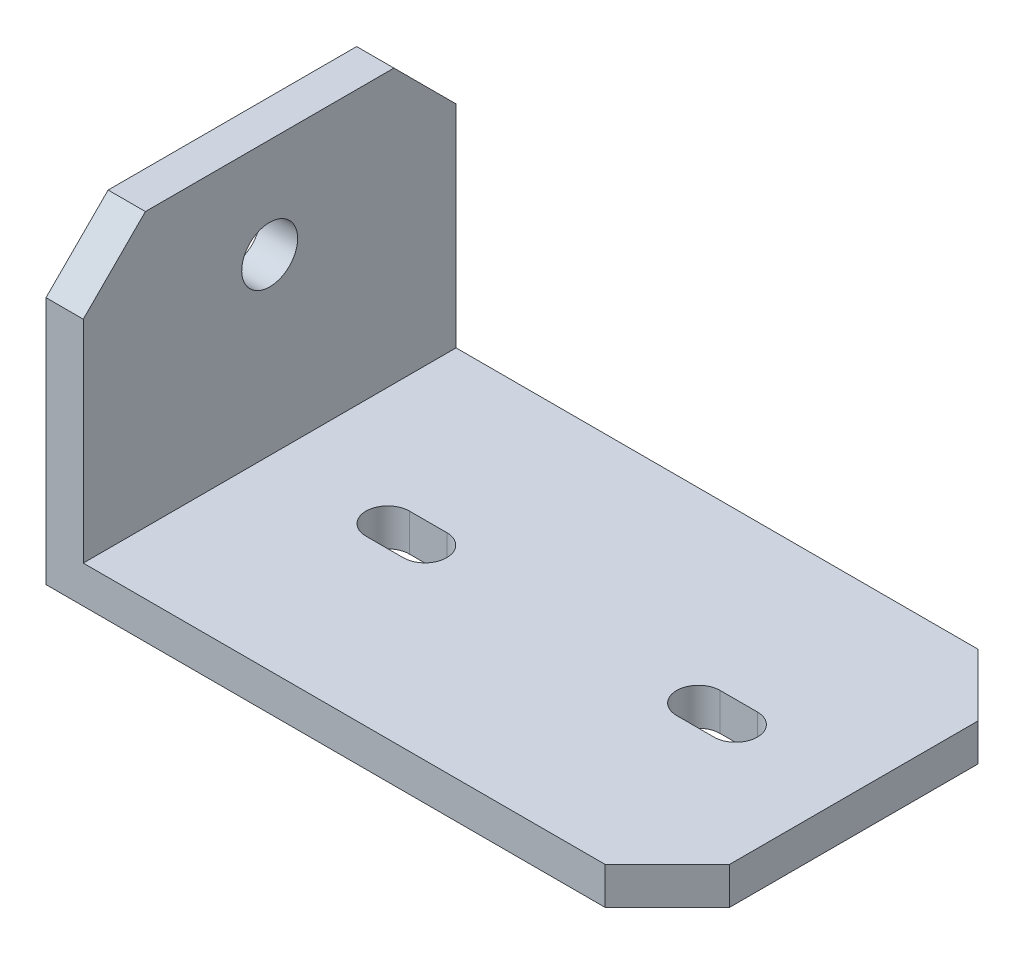
from build123d import *

# Parameters (mm, degrees)
BOSS_EXTRUDE1_DEPTH = 30
SKETCH2_R           = 2.25
CUT_EXTRUDE1_DEPTH  = 30
CUT_EXTRUDE2_DEPTH  = 30
CHAMFER1_SIZE       = 5


with BuildPart() as part:
    # Sketch1 → Boss-Extrude1 (new body)
    with BuildSketch(Plane.XY):
        Polygon((0, 22), (0, 0), (47, 0), (47, -3), (-3, -3), (-3, 22), align=None)
    extrude(amount=BOSS_EXTRUDE1_DEPTH)

    # Sketch2 → Cut-Extrude1 (cut)
    with BuildSketch(Plane(origin=(0, 0, 0), x_dir=(0, 0, -1), z_dir=(1, 0, 0))):
        with Locations((-15, 14)):
            Circle(SKETCH2_R)
    extrude(amount=-CUT_EXTRUDE1_DEPTH, mode=Mode.SUBTRACT)

    # Sketch3 → Cut-Extrude2 (cut)
    with BuildSketch(Plane(origin=(0, 0, 0), x_dir=(1, 0, 0), z_dir=(0, 1, 0))):
        with BuildLine():
            Line((9.5, -13.25), (12.5, -13.25))
            ThreePointArc((12.5, -13.25), (14.25, -15), (12.5, -16.75))
            Line((12.5, -16.75), (9.5, -16.75))
            ThreePointArc((9.5, -16.75), (7.75, -15), (9.5, -13.25))
        make_face()
        with BuildLine():
            Line((34.5, -13.25), (37.5, -13.25))
            ThreePointArc((37.5, -13.25), (39.25, -15), (37.5, -16.75))
            Line((37.5, -16.75), (34.5, -16.75))
            ThreePointArc((34.5, -16.75), (32.75, -15), (34.5, -13.25))
        make_face()
    extrude(amount=-CUT_EXTRUDE2_DEPTH, mode=Mode.SUBTRACT)

    # Chamfer1
    chamfer1_edges = [part.edges().sort_by_distance(p)[0] for p in [
        (-1.5, 22, 30),
        (-1.5, 22, 0),
        (47, -1.5, 30),
        (47, -1.5, 0),
    ]]
    chamfer(chamfer1_edges, length=CHAMFER1_SIZE)


solid = part.part
